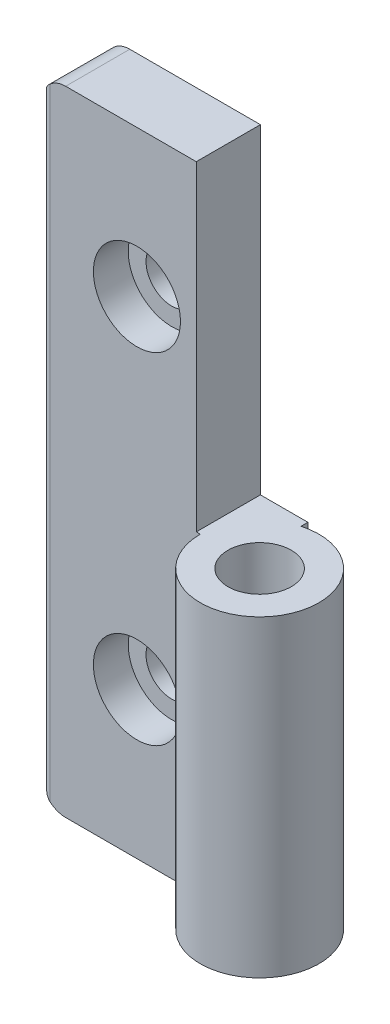
from build123d import *

# Parameters (mm, degrees)
EXTRUDE1_DEPTH       = 39.5
SKETCH2_W            = 19.5
SKETCH2_H            = 8.1
EXTRUDE2_DEPTH       = 40.5
HOLEWZD1_D           = 8
HOLEWZD1_DEPTH       = 80.000025
HOLEWZD2_D           = 6.5
HOLEWZD2_CBORE_D     = 11
HOLEWZD2_CBORE_DEPTH = 4.4
FILLET1_R            = 1
FILLET2_R            = 3


with BuildPart() as part:
    # Sketch1 → Extrude1 (new body)
    with BuildSketch(Plane.XZ.offset(40)):
        with BuildLine():
            Line((-2, -8.1), (-2, -7.228416147))
            ThreePointArc((-2, -7.228416147), (5.968668193, 4.541475531), (-7.5, 0))
            Line((-7.5, 0), (-27.5, 0))
            Line((-27.5, 0), (-27.5, -8.1))
            Line((-27.5, -8.1), (-2, -8.1))
        make_face()
    extrude(amount=-EXTRUDE1_DEPTH)

    # Sketch2 → Extrude2 (add)
    with BuildSketch(Plane(origin=(0, -0.5, 0), x_dir=(-1, 0, 0), z_dir=(0, 1, 0))):
        with Locations((17.75, -4.05)):
            Rectangle(SKETCH2_W, SKETCH2_H)
    extrude(amount=EXTRUDE2_DEPTH)

    # HoleWzd1
    with Locations(Plane(origin=(0, -40, 0), x_dir=(-1, 0, 0), z_dir=(0, -1, 0))):
        with Locations((0, 0)):
            Hole(HOLEWZD1_D / 2, depth=HOLEWZD1_DEPTH)

    # HoleWzd2 (through all)
    with Locations(Plane.XY):
        with Locations((-15.5, -21.5), (-15.5, 21.5)):
            CounterBoreHole(HOLEWZD2_D / 2, HOLEWZD2_CBORE_D / 2, HOLEWZD2_CBORE_DEPTH)

    # Fillet1
    fillet1_edges = [part.edges().sort_by_distance(p)[0] for p in [
        (-27.5, 0, 0),
    ]]
    fillet(fillet1_edges, radius=FILLET1_R)

    # Fillet2
    # the kernel refuses this fillet: 3 mm, written as the material it takes off along each edge
    with BuildSketch(Plane(origin=(-27.5, -40, 6.5), x_dir=(1, 0, 0), z_dir=(0, 0, -1)), Plane(origin=(-27.5, 40, 6.5), x_dir=(0, -1, 0), z_dir=(0, 0, -1))) as fillet2_piece_1:
        with BuildLine():
            CenterArc((FILLET2_R, -FILLET2_R), FILLET2_R, 90, 90)
            Line((0, -FILLET2_R), (0, 0))
            Line((0, 0), (FILLET2_R, 0))
        make_face()
    extrude(amount=22.1, mode=Mode.SUBTRACT)


solid = part.part
